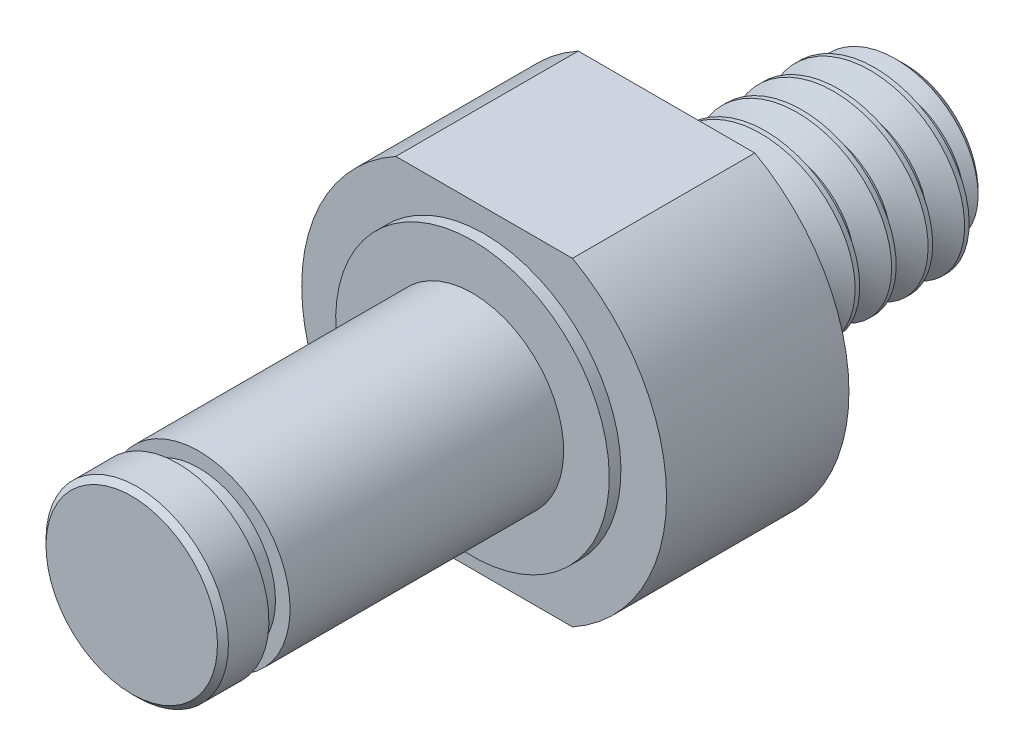
from build123d import *

# Parameters (mm, degrees)
CUT_EXTRUDE1_DEPTH = 21.670809642
CHAMFER1_SIZE      = 0.1905
CHAMFER2_SIZE      = 0.635
CUT_SWEEP1_PITCH   = 1.27


# Read off the part's stored shape, not the designer's step: Split1
with BuildPart() as part:
    # Sketch1 → Revolve1 (revolve)
    with BuildSketch(Plane(origin=(0, 0, 0), x_dir=(0, 0, -1), z_dir=(1, 0, 0))):
        Polygon((-13.462, 0), (-13.462, 3.175), (-11.8618, 3.175), (-11.8618, 2.667), (-11.1252, 2.667), (-11.1252, 3.175), (-1.6002, 3.175), (-1.6002, 4.7625), (-1.1938, 4.7625), (-1.1938, 6.35), (5.1562, 6.35), (5.1562, 3.175), (13.462, 3.175), (13.462, 0), align=None)
    revolve(axis=Axis((0, 0, -13.462), (0, 0, 1)))

    # Sketch14 → Cut-Extrude1 (cut, through all)
    with BuildSketch(Plane(origin=(0, 0, -5.1562), x_dir=(-1, 0, 0), z_dir=(0, 0, -1))):
        with BuildLine():
            Line((-3.074180531, 5.55625), (3.074180531, 5.55625))
            ThreePointArc((3.074180531, 5.55625), (0, 6.35), (-3.074180531, 5.55625))
        make_face()
        with BuildLine():
            Line((-3.074180531, -5.55625), (3.074180531, -5.55625))
            ThreePointArc((3.074180531, -5.55625), (0, -6.35), (-3.074180531, -5.55625))
        make_face()
    extrude(amount=-CUT_EXTRUDE1_DEPTH, mode=Mode.SUBTRACT)

    # Chamfer1
    chamfer1_edges = [part.edges().sort_by_distance(p)[0] for p in [
        (0, -3.175, 13.462),
    ]]
    chamfer(chamfer1_edges, length=CHAMFER1_SIZE)

    # Chamfer2
    chamfer2_edges = [part.edges().sort_by_distance(p)[0] for p in [
        (0, -3.175, -13.462),
    ]]
    chamfer(chamfer2_edges, length=CHAMFER2_SIZE)

    # Sketch15 → Cut-Revolve1 (revolve, cut)
    with BuildSketch(Plane(origin=(0, 0, 0), x_dir=(0, 0, -1), z_dir=(1, 0, 0))):
        Polygon((5.1562, 3.175), (7.6962, 3.175), (6.7437, 2.2225), (5.1562, 2.2225), align=None)
    revolve(axis=Axis((0, 0, -13.462), (0, 0, 1)), mode=Mode.SUBTRACT)


with BuildPart() as body_2:
    # Split1: the piece on the far side of the plane
    add(part.part)
    split(bisect_by=Plane.XY.offset(-5.1562), keep=Keep.BOTTOM)

    # Cut-Sweep1: the profile of Sketch17 screwed along a right-hand helix of 6.86 turns, 8 arcs to a turn; built about Z, then put on its axis
    cut_sweep1_z = Axis((0, 0, 0), (0, 0, 1))
    cut_sweep1_corners = [(3.243740766, 0, 0.0396875), (3.243740766, 0, -1.1509375), (2.350110803, 0, -0.635), (2.350110803, 0, -0.47625)]
    with BuildLine(mode=Mode.PRIVATE) as cut_sweep1_profile:
        Line(cut_sweep1_corners[0], cut_sweep1_corners[1])
        Line(cut_sweep1_corners[1], cut_sweep1_corners[2])
        Line(cut_sweep1_corners[2], cut_sweep1_corners[3])
        Line(cut_sweep1_corners[3], cut_sweep1_corners[0])
    cut_sweep1_cap = Face(cut_sweep1_profile.wire())
    cut_sweep1_turn_angles = [0, 22.5, 45, 67.5, 90, 112.5, 135, 157.5, 180, 202.5, 225, 247.5, 270, 292.5, 315, 337.5, 360]
    cut_sweep1_turn_weights = [1, 0.9238795325112867, 1, 0.9238795325112867, 1, 0.9238795325112867, 1, 0.9238795325112867, 1, 0.9238795325112867, 1, 0.9238795325112867, 1, 0.9238795325112867, 1, 0.9238795325112867, 1]
    cut_sweep1_turn_rails = [Edge.make_bspline([Vector(p[0], p[1], 0).rotate(cut_sweep1_z, cut_sweep1_turn_angles[k]) / cut_sweep1_turn_weights[k] + Vector(0, 0, p[2] + CUT_SWEEP1_PITCH * cut_sweep1_turn_angles[k] / 360) for k in range(17)], [0, 0, 0, 1, 1, 2, 2, 3, 3, 4, 4, 5, 5, 6, 6, 7, 7, 8, 8, 8], 2, cut_sweep1_turn_weights) for p in cut_sweep1_corners]
    cut_sweep1_turn_sides = [Face.make_surface_from_curves(cut_sweep1_turn_rails[p[0]], cut_sweep1_turn_rails[p[1]]) for p in [(0, 1), (1, 2), (2, 3), (3, 0)]]
    cut_sweep1_last_angles = [2160, 2182.5, 2205, 2227.5, 2250, 2272.5, 2295, 2317.5, 2340, 2362.5, 2385, 2407.5, 2430, 2449.8, 2469.6]
    cut_sweep1_last_weights = [1, 0.9238795325112867, 1, 0.9238795325112867, 1, 0.9238795325112867, 1, 0.9238795325112867, 1, 0.9238795325112867, 1, 0.9238795325112867, 1, 0.9408807689542096, 1]
    cut_sweep1_last_rails = [Edge.make_bspline([Vector(p[0], p[1], 0).rotate(cut_sweep1_z, cut_sweep1_last_angles[k]) / cut_sweep1_last_weights[k] + Vector(0, 0, p[2] + CUT_SWEEP1_PITCH * cut_sweep1_last_angles[k] / 360) for k in range(15)], [0, 0, 0, 1, 1, 2, 2, 3, 3, 4, 4, 5, 5, 6, 6, 7, 7, 7], 2, cut_sweep1_last_weights) for p in cut_sweep1_corners]
    cut_sweep1_last_sides = [Face.make_surface_from_curves(cut_sweep1_last_rails[p[0]], cut_sweep1_last_rails[p[1]]) for p in [(0, 1), (1, 2), (2, 3), (3, 0)]]
    cut_sweep1 = Plane(origin=(0, 0, -13.462), x_dir=(0, 1, 0), z_dir=(0, 0, 1)) * Solid(Shell([*[p.moved(Location((0, 0, CUT_SWEEP1_PITCH * i))) for i in range(6) for p in cut_sweep1_turn_sides], *cut_sweep1_last_sides, cut_sweep1_cap, cut_sweep1_cap.rotate(cut_sweep1_z, 2469.6).moved(Location((0, 0, CUT_SWEEP1_PITCH * 2469.6 / 360)))]))
    add(cut_sweep1, mode=Mode.SUBTRACT)


with BuildPart() as part_1:
    add(part.part)

    # Split1
    split(bisect_by=Plane.XY.offset(-5.1562), keep=Keep.TOP)

    # Combine1: union body 2
    add(body_2.part)


solid = part_1.part
